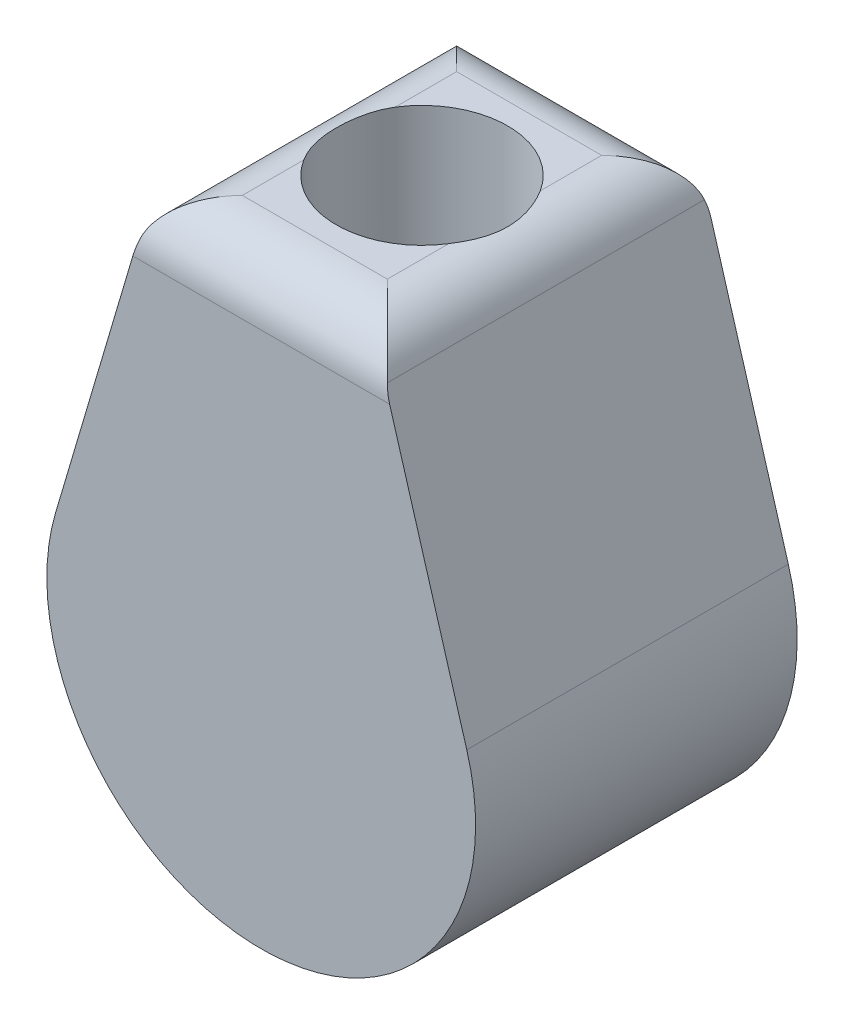
from build123d import *

# Parameters (mm, degrees)
BOSS_EXTRUDE1_DEPTH = 6
BOSS_EXTRUDE2_DEPTH = 8
FILLET1_R           = 1


with BuildPart() as part:
    # Sketch1 → Boss-Extrude1 (new body)
    with BuildSketch(Plane.XY):
        with BuildLine():
            Line((-1.6, 0), (-2.1, 0))
            Line((-2.1, 0), (-3.835581375, -5.864960127))
            ThreePointArc((-3.835581375, -5.864960127), (0, -11), (3.835581375, -5.864960127))
            Line((3.835581375, -5.864960127), (2.1, 0))
            Line((2.1, 0), (1.6, 0))
            Line((1.6, 0), (1.6, -8))
            Line((1.6, -8), (0, -8))
            Line((0, -8), (-1.6, -8))
            Line((-1.6, -8), (-1.6, 0))
        make_face()
    extrude(amount=BOSS_EXTRUDE1_DEPTH)

    # Sketch2 → Boss-Extrude2 (add)
    with BuildSketch(Plane(origin=(0, -8, 0), x_dir=(1, 0, 0), z_dir=(0, 1, 0))):
        with BuildLine():
            Line((1.6, -6), (1.6, -3))
            ThreePointArc((1.6, -3), (0, -4.6), (-1.6, -3))
            Line((-1.6, -3), (-1.6, -6))
            Line((-1.6, -6), (1.6, -6))
        make_face()
        with BuildLine():
            Line((1.6, -3), (1.6, 0))
            Line((1.6, 0), (-1.6, 0))
            Line((-1.6, 0), (-1.6, -3))
            ThreePointArc((-1.6, -3), (0, -1.4), (1.6, -3))
        make_face()
    extrude(amount=BOSS_EXTRUDE2_DEPTH)

    # Fillet1
    # the kernel refuses this fillet: 1 mm, written as the material it takes off along each edge
    with BuildSketch(Plane(origin=(-4.6, 0, 0), x_dir=(0, 0, 1), z_dir=(1, 0, 0))) as fillet1_piece_1:
        with BuildLine():
            CenterArc((FILLET1_R, FILLET1_R), FILLET1_R, 180, 90)
            Line((0, FILLET1_R), (0, 0))
            Line((0, 0), (FILLET1_R, 0))
        make_face()
    extrude(amount=9.2, mode=Mode.SUBTRACT)
    with BuildSketch(Plane(origin=(2.1, 0, -1.867357153), x_dir=(-1, 0, 0), z_dir=(0, 0, 1))) as fillet1_piece_2:
        with BuildLine():
            CenterArc((FILLET1_R * 0.746942861214, FILLET1_R), FILLET1_R, 196.484740183, 73.515259817)
            Line((-FILLET1_R * 0.211952482607, FILLET1_R * 0.716240031718), (0, 0))
            Line((0, 0), (FILLET1_R * 0.746942861214, 0))
        make_face()
    extrude(amount=9.734714306, mode=Mode.SUBTRACT)
    with BuildSketch(Plane(origin=(-2.1, 0, -1.867357153), x_dir=(1, 0, 0), z_dir=(0, 0, 1))) as fillet1_piece_3:
        with BuildLine():
            CenterArc((FILLET1_R * 0.746942861214, -FILLET1_R), FILLET1_R, 90, 73.515259817)
            Line((-FILLET1_R * 0.211952482607, -FILLET1_R * 0.716240031718), (0, 0))
            Line((0, 0), (FILLET1_R * 0.746942861214, 0))
        make_face()
    extrude(amount=9.734714306, mode=Mode.SUBTRACT)
    with BuildSketch(Plane(origin=(4.6, 0, 6), x_dir=(0, -1, 0), z_dir=(-1, 0, 0))) as fillet1_piece_4:
        with BuildLine():
            CenterArc((FILLET1_R, -FILLET1_R), FILLET1_R, 90, 90)
            Line((0, -FILLET1_R), (0, 0))
            Line((0, 0), (FILLET1_R, 0))
        make_face()
    extrude(amount=9.2, mode=Mode.SUBTRACT)


solid = part.part
